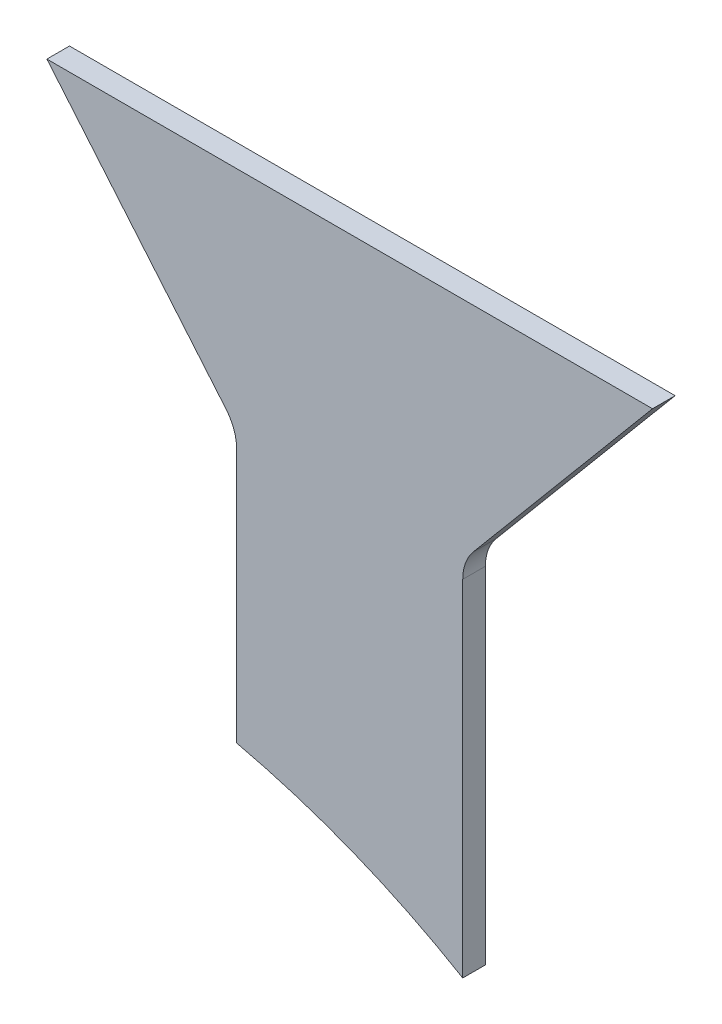
from build123d import *

# Parameters (mm, degrees)
FUNNEL_SIDE_PANEL_DEPTH = 5
FILLET1_R               = 10


with BuildPart() as part:
    # Sketch1 → Funnel - Side Panel (new body)
    with BuildSketch(Plane.XY):
        with BuildLine():
            Line((25, 0), (25, 80))
            Line((25, 80), (66.974030913, 130.022702136))
            Line((66.974030913, 130.022702136), (-66.974030913, 130.022702136))
            Line((-66.974030913, 130.022702136), (-25, 80))
            Line((-25, 80), (-25, 20))
            ThreePointArc((-25, 20), (0.773917017, 11.934792543), (25, 0))
        make_face()
    extrude(amount=FUNNEL_SIDE_PANEL_DEPTH)

    # Fillet1
    fillet1_edges = [part.edges().sort_by_distance(p)[0] for p in [
        (-25, 80, 2.5),
        (25, 80, 2.5),
    ]]
    fillet(fillet1_edges, radius=FILLET1_R)


solid = part.part
